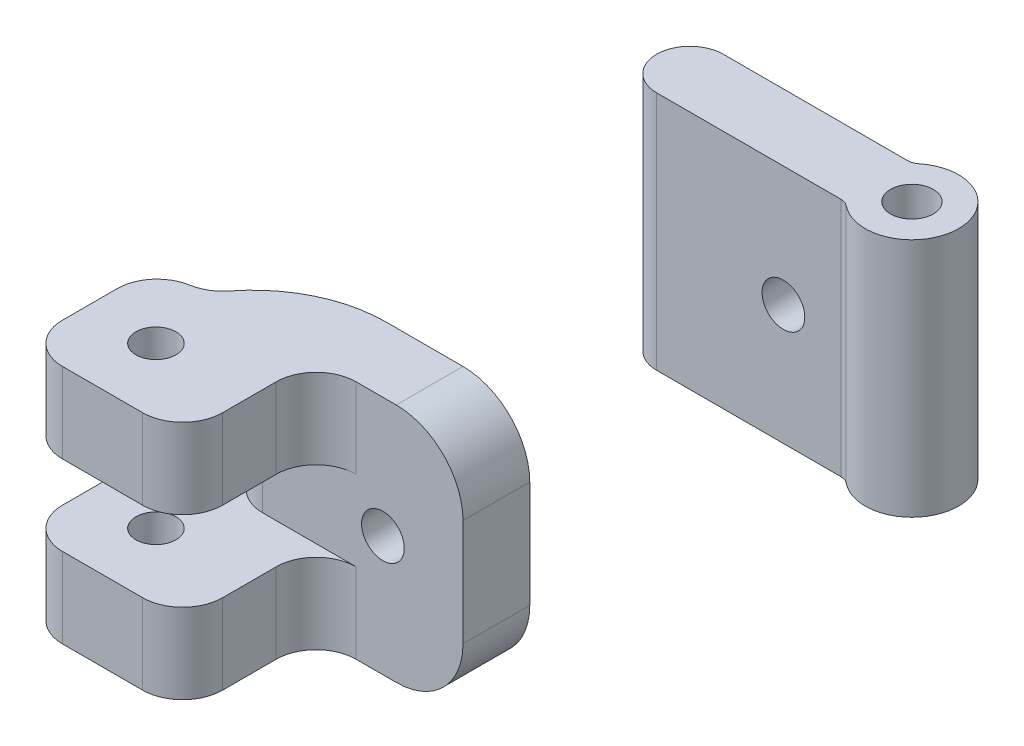
from build123d import *

# Parameters (mm, degrees)
SKETCH1_W               = 20.25
SKETCH1_H               = 18
BOSS_EXTRUDE1_DEPTH     = 5
SKETCH2_W               = 5
SKETCH2_H               = 18
BOSS_EXTRUDE2_DEPTH     = 25
SKETCH3_W               = 18
SKETCH3_H               = 18
BOSS_EXTRUDE3_DEPTH     = 5
CUT_EXTRUDE2_DEPTH      = 33.916798523
CUT_EXTRUDE2_DEPTH_BACK = 33.916798523
SKETCH5_R               = 1.6
FILLET7_R               = 5
CUT_EXTRUDE4_DEPTH      = 41.638843795
CUT_EXTRUDE4_DEPTH_BACK = 41.638843795
SKETCH10_R              = 1.6
SKETCH10_4_R            = 3.5
SKETCH10_4_R_2          = 1.6
BOSS_EXTRUDE7_DEPTH     = 18
FILLET13_R              = 1
SKETCH11_W              = 12
SKETCH11_H              = 6
BOSS_EXTRUDE8_DEPTH     = 10
CUT_EXTRUDE5_DEPTH      = 51.771701025
CUT_EXTRUDE5_DEPTH_BACK = 51.771701025
SKETCH12_R              = 1.5
FILLET17_R              = 3
FILLET18_R              = 3
FILLET19_R              = 3
SKETCH13_W              = 25
SKETCH13_H              = 18
CUT_EXTRUDE6_DEPTH      = 10
FILLET20_R              = 10
FILLET21_R              = 2.5


# Some blends are built 0.0001 mm under size
with BuildPart() as part:
    # Sketch1 → Boss-Extrude1 (new body)
    with BuildSketch(Plane.XY):
        Rectangle(SKETCH1_W, SKETCH1_H)
    extrude(amount=BOSS_EXTRUDE1_DEPTH)

    # Sketch2 → Boss-Extrude2 (add)
    with BuildSketch(Plane.XY.offset(5)):
        with Locations((-7.625, 0)):
            Rectangle(SKETCH2_W, SKETCH2_H)
    extrude(amount=BOSS_EXTRUDE2_DEPTH)

    # Sketch3 → Boss-Extrude3 (add)
    with BuildSketch(Plane.XY.offset(30)):
        with Locations((-1.125, 0)):
            Rectangle(SKETCH3_W, SKETCH3_H)
    extrude(amount=BOSS_EXTRUDE3_DEPTH)

    # Sketch5 → Cut-Extrude2 (cut, two sides: drawn at the far end of the back side and taken through both)
    with BuildSketch(Plane(origin=(0, 0, 30), x_dir=(-1, 0, 0), z_dir=(0, 0, -1)).offset(-CUT_EXTRUDE2_DEPTH_BACK)):
        with Locations((-1.875, 0)):
            Circle(SKETCH5_R)
    extrude(amount=CUT_EXTRUDE2_DEPTH + CUT_EXTRUDE2_DEPTH_BACK, mode=Mode.SUBTRACT)

    # Fillet7
    fillet7_edges = [part.edges().sort_by_distance(p)[0] for p in [
        (7.875, -9, 32.5),
        (7.875, 9, 32.5),
    ]]
    fillet(fillet7_edges, radius=FILLET7_R)

    # Sketch10 → Cut-Extrude4 (cut, two sides: drawn at the far end of the back side and taken through both)
    with BuildSketch(Plane.XZ.offset(9).offset(-CUT_EXTRUDE4_DEPTH_BACK)):
        with Locations((9, 2.5)):
            Circle(SKETCH10_R)
    extrude(amount=CUT_EXTRUDE4_DEPTH + CUT_EXTRUDE4_DEPTH_BACK, mode=Mode.SUBTRACT)

    # Sketch10<4> → Boss-Extrude7 (add)
    with BuildSketch(Plane.XZ.offset(9)):
        with Locations((9, 2.5)):
            Circle(SKETCH10_4_R)
        with Locations(Location((9, 2.5, 0), (0, 0, 270))):
            Circle(SKETCH10_4_R_2, mode=Mode.SUBTRACT)
    extrude(amount=-BOSS_EXTRUDE7_DEPTH)

    # Fillet13
    fillet13_edges = [part.edges().sort_by_distance(p)[0] for p in [
        (6.550510257, 0, 0),
        (6.550510257, 0, 5),
    ]]
    fillet(fillet13_edges, radius=FILLET13_R)

    # Sketch11 → Boss-Extrude8 (add)
    with BuildSketch(Plane.XY.offset(35)):
        with Locations((-9.125, 6)):
            Rectangle(SKETCH11_W, SKETCH11_H)
        with Locations((-9.125, -6)):
            Rectangle(SKETCH11_W, SKETCH11_H)
    extrude(amount=BOSS_EXTRUDE8_DEPTH)

    # Sketch12 → Cut-Extrude5 (cut, two sides: drawn at the far end of the back side and taken through both)
    with BuildSketch(Plane(origin=(0, 9, 0), x_dir=(1, 0, 0), z_dir=(0, 1, 0)).offset(-CUT_EXTRUDE5_DEPTH_BACK)):
        with Locations(Location((-10.125, -40, 0), (0, 0, 90))):
            Circle(SKETCH12_R)
    extrude(amount=CUT_EXTRUDE5_DEPTH + CUT_EXTRUDE5_DEPTH_BACK, mode=Mode.SUBTRACT)

    # Fillet17
    fillet17_edges = [part.edges().sort_by_distance(p)[0] for p in [
        (-10.125, -6, 35),
        (-15.125, 6, 45),
        (-3.125, 6, 35),
        (-3.125, 6, 45),
        (-3.125, -6, 35),
        (-3.125, -6, 45),
        (-15.125, -6, 45),
        (-10.125, 6, 35),
    ]]
    fillet(fillet17_edges, radius=FILLET17_R)

    # Fillet18
    fillet18_edges = [part.edges().sort_by_distance(p)[0] for p in [
        (-15.125, 6, 35),
        (-15.125, -6, 35),
    ]]
    fillet(fillet18_edges, radius=FILLET18_R)

    # Fillet19
    fillet19_edges = [part.edges().sort_by_distance(p)[0] for p in [
        (-10.125, 0, 35),
    ]]
    fillet(fillet19_edges, radius=FILLET19_R)

    # Sketch13 → Cut-Extrude6 (cut)
    with BuildSketch(Plane(origin=(-5.125, 0, 0), x_dir=(0, 0, -1), z_dir=(1, 0, 0))):
        with Locations((-17.5, 0)):
            Rectangle(SKETCH13_W, SKETCH13_H)
    extrude(amount=-CUT_EXTRUDE6_DEPTH, mode=Mode.SUBTRACT)


with BuildPart() as cut_extrude6_piece_1:
    # of the separate pieces the step leaves, piece 1, a body of its own (cut_extrude6_pieces)
    add(part.part.solids().sort_by_distance((-10.125, -9, 32))[0])

    # Fillet20
    # the kernel refuses this fillet: 10 mm, written as the material it takes off along each edge
    with BuildSketch(Plane(origin=(-10.125, 27.117376915, 30), x_dir=(-0.16297450432591723, 0, 0.9866302807737667), z_dir=(0, -1, 0))) as fillet20_piece_1:
        with BuildLine():
            CenterArc((8.685234599, -8.779806112), FILLET20_R, 118.600282976, 52.020127555)
            Line((-1.181068209, -7.150061069), (-2.16769849, -6.987086565))
            Line((-2.16769849, -6.987086565), (-0.986630281, 0.162974504))
            Line((-0.986630281, 0.162974504), (0.162974504, 0.986630281))
            ThreePointArc((0.162974504, 0.986630281), (2.136235066, 0.660681272), (3.419576463, 0.877980611))
            Line((3.419576463, 0.877980611), (3.898272657, 0))
        make_face()
    extrude(amount=54.23475383, mode=Mode.SUBTRACT)


with BuildPart() as cut_extrude6_piece_2:
    # of the separate pieces the step leaves, piece 2, a body of its own (cut_extrude6_pieces)
    add(part.part.solids().sort_by_distance((-10.125, -9, 0))[0])

    # Fillet21
    fillet21_edges = [cut_extrude6_piece_2.edges().sort_by_distance(p)[0] for p in [
        (-10.125, 0, 0),
        (-10.125, 0, 5),
    ]]
    fillet(fillet21_edges, radius=FILLET21_R - 0.0001)  # a hair under: the kernel refuses the full size


solid = Compound([cut_extrude6_piece_1.part, cut_extrude6_piece_2.part])
